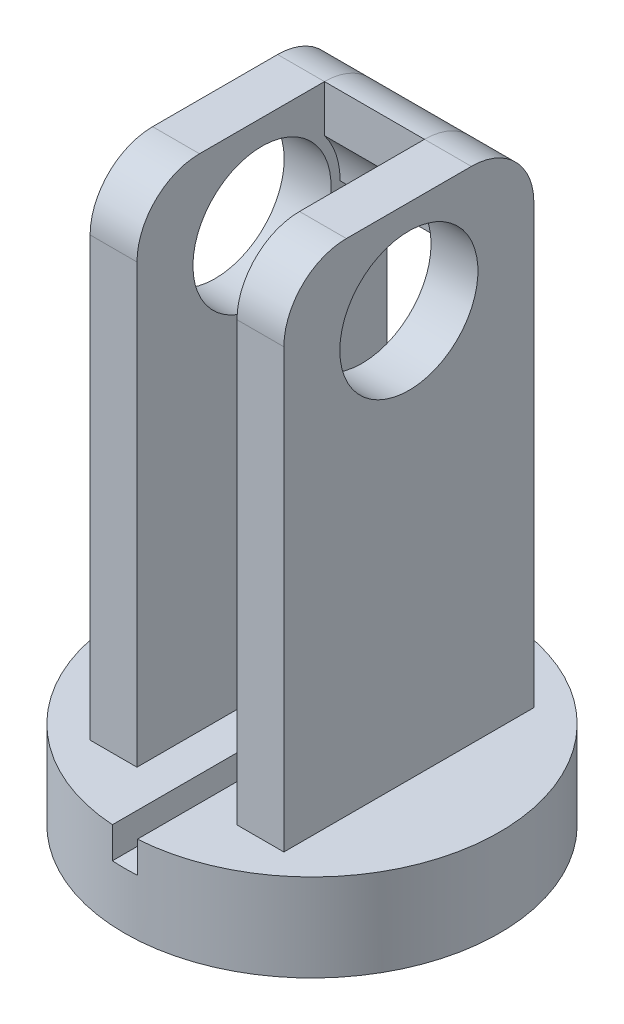
from build123d import *

# Parameters (mm, degrees)
SKETCH1_R               = 30
BOSS_EXTRUDE1_DEPTH     = 14
SKETCH2_R               = 11.05
CUT_EXTRUDE1_DEPTH      = 7
SKETCH5_W               = 7.5
SKETCH5_H               = 40
BOSS_EXTRUDE2_DEPTH     = 80
FILLET1_R               = 10
CUT_EXTRUDE3_DEPTH      = 109.656569061
CUT_EXTRUDE3_DEPTH_BACK = 109.656569061
SKETCH7_R               = 11.05
CUT_EXTRUDE4_START      = -5
CUT_EXTRUDE4_DEPTH      = 5
BOSS_EXTRUDE4_DEPTH     = 16
FILLET2_R               = 10


with BuildPart() as part:
    # Sketch1 → Boss-Extrude1 (new body)
    with BuildSketch(Plane(origin=(0, 0, 0), x_dir=(1, 0, 0), z_dir=(0, 1, 0))):
        with Locations(Location((0, 0, 0), (0, 0, 90))):
            Circle(SKETCH1_R)
    extrude(amount=BOSS_EXTRUDE1_DEPTH)

    # Sketch2 → Cut-Extrude1 (cut)
    with BuildSketch(Plane.XZ):
        with Locations(Location((0, 0, 0), (0, 0, 270))):
            Circle(SKETCH2_R)
    extrude(amount=-CUT_EXTRUDE1_DEPTH, mode=Mode.SUBTRACT)

    # Sketch5 → Boss-Extrude2 (add)
    with BuildSketch(Plane(origin=(0, 14, 0), x_dir=(1, 0, 0), z_dir=(0, 1, 0))):
        with Locations((-11.75, 0)):
            Rectangle(SKETCH5_W, SKETCH5_H)
        with Locations((11.75, 0)):
            Rectangle(SKETCH5_W, SKETCH5_H)
    extrude(amount=BOSS_EXTRUDE2_DEPTH)

    # Fillet1
    fillet1_edges = [part.edges().sort_by_distance(p)[0] for p in [
        (-11.75, 94, 20),
        (-11.75, 94, -20),
        (11.75, 94, 20),
        (11.75, 94, -20),
    ]]
    fillet(fillet1_edges, radius=FILLET1_R)

    # Sketch7 → Cut-Extrude3 (cut, two sides: drawn at the far end of the back side and taken through both)
    with BuildSketch(Plane.ZY.offset(15.5).offset(-CUT_EXTRUDE3_DEPTH_BACK)):
        with Locations((0, 79)):
            Circle(SKETCH7_R)
    extrude(amount=CUT_EXTRUDE3_DEPTH + CUT_EXTRUDE3_DEPTH_BACK, mode=Mode.SUBTRACT)

    # Sketch8 → Cut-Extrude4 (cut)
    with BuildSketch(Plane(origin=(0, 14, 0), x_dir=(1, 0, 0), z_dir=(0, 1, 0)).offset(CUT_EXTRUDE4_START)):
        with BuildLine():
            Line((2, 29.933259094), (2, -29.933259094))
            ThreePointArc((2, -29.933259094), (0, -30), (-2, -29.933259094))
            Line((-2, -29.933259094), (-2, 29.933259094))
            ThreePointArc((-2, 29.933259094), (0, 30), (2, 29.933259094))
        make_face()
    extrude(amount=CUT_EXTRUDE4_DEPTH, mode=Mode.SUBTRACT)

    # Sketch9 → Boss-Extrude4 (add)
    with BuildSketch(Plane.ZY.offset(-8)):
        with BuildLine():
            Line((-10, 86.5), (-10, 94))
            Line((-10, 94), (-20, 94))
            Line((-20, 94), (-20, 79))
            Line((-20, 79), (-12.5, 79))
            ThreePointArc((-12.5, 79), (-11.858541226, 82.952847075), (-10, 86.5))
        make_face()
    extrude(amount=BOSS_EXTRUDE4_DEPTH)

    # Fillet2
    fillet2_edges = [part.edges().sort_by_distance(p)[0] for p in [
        (0, 94, -20),
    ]]
    fillet(fillet2_edges, radius=FILLET2_R - 0.0001)  # a hair under: the kernel refuses the full size


solid = part.part
